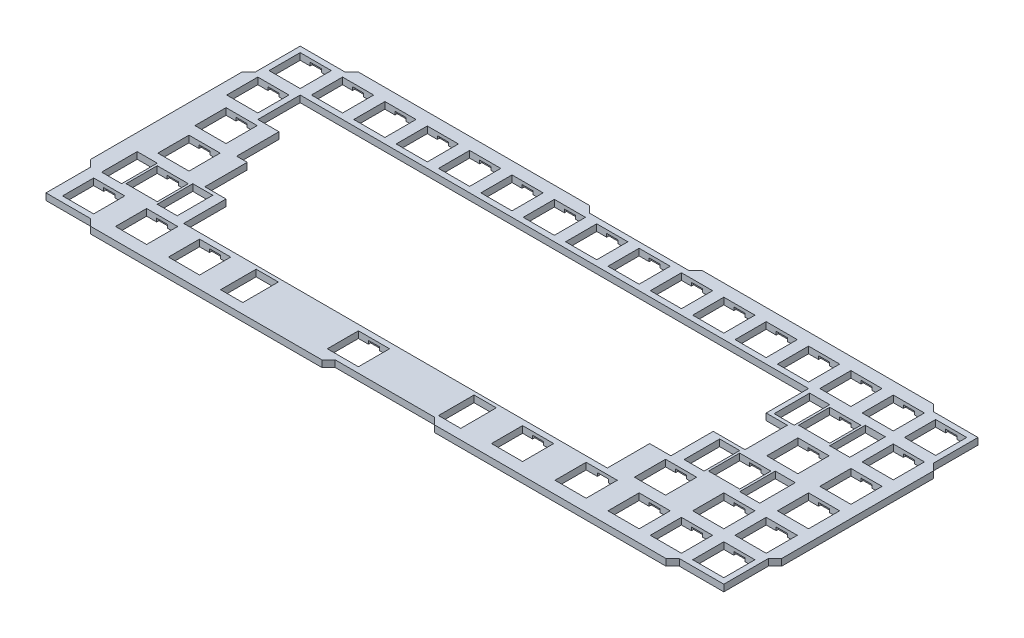
from build123d import *

# Parameters (mm, degrees)
SKETCH1_W           = 14
SKETCH1_H           = 14
BOSS_EXTRUDE1_DEPTH = 3
SKETCH2_W           = 9
SKETCH2_H           = 16
SKETCH2_W_2         = 10
CUT_EXTRUDE1_DEPTH  = 326.540366161
SKETCH3_W           = 5
SKETCH3_H           = 16
CUT_EXTRUDE2_DEPTH  = 1.5
SKETCH4_W           = 110
SKETCH4_H           = 3
BOSS_EXTRUDE2_DEPTH = 3
SKETCH5_W           = 110
SKETCH5_H           = 3
BOSS_EXTRUDE3_DEPTH = 3
SKETCH6_W           = 74.3
SKETCH6_H           = 3
BOSS_EXTRUDE4_DEPTH = 3
SKETCH7_W           = 74.3
SKETCH7_H           = 3
BOSS_EXTRUDE5_DEPTH = 3
CHAMFER3_SIZE       = 3


with BuildPart() as part:
    # Sketch1 → Boss-Extrude1 (new body)
    with BuildSketch(Plane(origin=(0, 0, 0), x_dir=(1, 0, 0), z_dir=(0, 1, 0))):
        Polygon((23.81, -114.3), (266.7, -114.3), (285.75, -114.3), (304.8, -114.3), (304.8, 0), (0, 0), (0, -114.3), align=None)
        with Locations((11.90625, -104.775)):
            Rectangle(SKETCH1_W, SKETCH1_H, mode=Mode.SUBTRACT)
        with Locations((35.71625, -104.775)):
            Rectangle(SKETCH1_W, SKETCH1_H, mode=Mode.SUBTRACT)
        with Locations((59.52625, -104.775)):
            Rectangle(SKETCH1_W, SKETCH1_H, mode=Mode.SUBTRACT)
        with Locations((21.43125, -85.725)):
            Rectangle(SKETCH1_W, SKETCH1_H, mode=Mode.SUBTRACT)
        with Locations((16.66875, -66.675)):
            Rectangle(SKETCH1_W, SKETCH1_H, mode=Mode.SUBTRACT)
        Polygon((233.3625, -95.25), (42.8625, -95.25), (42.8625, -76.2), (33.3375, -76.2), (33.3375, -57.15), (28.575, -57.15), (28.575, -38.1), (19.05, -38.1), (19.05, -19.05), (247.65, -19.05), (247.65, -38.1), (257.175, -38.1), (257.175, -57.15), (242.8875, -57.15), (242.8875, -76.2), (233.3625, -76.2), align=None, mode=Mode.SUBTRACT)
        with Locations((130.96375, -104.775)):
            Rectangle(SKETCH1_W, SKETCH1_H, mode=Mode.SUBTRACT)
        with Locations((204.7825, -104.775)):
            Rectangle(SKETCH1_W, SKETCH1_H, mode=Mode.SUBTRACT)
        with Locations((233.3625, -104.775)):
            Rectangle(SKETCH1_W, SKETCH1_H, mode=Mode.SUBTRACT)
        with Locations((257.175, -104.775)):
            Rectangle(SKETCH1_W, SKETCH1_H, mode=Mode.SUBTRACT)
        with Locations((276.225, -104.775)):
            Rectangle(SKETCH1_W, SKETCH1_H, mode=Mode.SUBTRACT)
        with Locations((295.275, -104.775)):
            Rectangle(SKETCH1_W, SKETCH1_H, mode=Mode.SUBTRACT)
        with Locations((250.03125, -85.725)):
            Rectangle(SKETCH1_W, SKETCH1_H, mode=Mode.SUBTRACT)
        with Locations((276.225, -85.725)):
            Rectangle(SKETCH1_W, SKETCH1_H, mode=Mode.SUBTRACT)
        with Locations((295.275, -85.725)):
            Rectangle(SKETCH1_W, SKETCH1_H, mode=Mode.SUBTRACT)
        with Locations((264.31875, -66.675)):
            Rectangle(SKETCH1_W, SKETCH1_H, mode=Mode.SUBTRACT)
        with Locations((295.275, -66.675)):
            Rectangle(SKETCH1_W, SKETCH1_H, mode=Mode.SUBTRACT)
        with Locations((14.2875, -47.625)):
            Rectangle(SKETCH1_W, SKETCH1_H, mode=Mode.SUBTRACT)
        with Locations((9.525, -28.575)):
            Rectangle(SKETCH1_W, SKETCH1_H, mode=Mode.SUBTRACT)
        with Locations((9.525, -9.525)):
            Rectangle(SKETCH1_W, SKETCH1_H, mode=Mode.SUBTRACT)
        with Locations((28.575, -9.525)):
            Rectangle(SKETCH1_W, SKETCH1_H, mode=Mode.SUBTRACT)
        with Locations((47.625, -9.525)):
            Rectangle(SKETCH1_W, SKETCH1_H, mode=Mode.SUBTRACT)
        with Locations((66.675, -9.525)):
            Rectangle(SKETCH1_W, SKETCH1_H, mode=Mode.SUBTRACT)
        with Locations((85.725, -9.525)):
            Rectangle(SKETCH1_W, SKETCH1_H, mode=Mode.SUBTRACT)
        with Locations((104.775, -9.525)):
            Rectangle(SKETCH1_W, SKETCH1_H, mode=Mode.SUBTRACT)
        with Locations((123.825, -9.525)):
            Rectangle(SKETCH1_W, SKETCH1_H, mode=Mode.SUBTRACT)
        with Locations((142.875, -9.525)):
            Rectangle(SKETCH1_W, SKETCH1_H, mode=Mode.SUBTRACT)
        with Locations((271.4625, -47.625)):
            Rectangle(SKETCH1_W, SKETCH1_H, mode=Mode.SUBTRACT)
        with Locations((295.275, -47.625)):
            Rectangle(SKETCH1_W, SKETCH1_H, mode=Mode.SUBTRACT)
        with Locations((161.925, -9.525)):
            Rectangle(SKETCH1_W, SKETCH1_H, mode=Mode.SUBTRACT)
        with Locations((180.975, -9.525)):
            Rectangle(SKETCH1_W, SKETCH1_H, mode=Mode.SUBTRACT)
        with Locations((200.025, -9.525)):
            Rectangle(SKETCH1_W, SKETCH1_H, mode=Mode.SUBTRACT)
        with Locations((219.075, -9.525)):
            Rectangle(SKETCH1_W, SKETCH1_H, mode=Mode.SUBTRACT)
        with Locations((266.7, -28.575)):
            Rectangle(SKETCH1_W, SKETCH1_H, mode=Mode.SUBTRACT)
        with Locations((295.275, -28.575)):
            Rectangle(SKETCH1_W, SKETCH1_H, mode=Mode.SUBTRACT)
        with Locations((238.125, -9.525)):
            Rectangle(SKETCH1_W, SKETCH1_H, mode=Mode.SUBTRACT)
        with Locations((257.175, -9.525)):
            Rectangle(SKETCH1_W, SKETCH1_H, mode=Mode.SUBTRACT)
        with Locations((276.225, -9.525)):
            Rectangle(SKETCH1_W, SKETCH1_H, mode=Mode.SUBTRACT)
        with Locations((295.275, -9.525)):
            Rectangle(SKETCH1_W, SKETCH1_H, mode=Mode.SUBTRACT)
    extrude(amount=BOSS_EXTRUDE1_DEPTH)

    # Sketch2 → Cut-Extrude1 (cut, through all)
    with BuildSketch(Plane(origin=(0, 3, 0), x_dir=(1, 0, 0), z_dir=(0, 1, 0))):
        with Locations((254.2, -28.575)):
            Rectangle(SKETCH2_W, SKETCH2_H)
        with Locations((279.2, -28.575)):
            Rectangle(SKETCH2_W, SKETCH2_H)
        with Locations((276.81875, -66.675)):
            Rectangle(SKETCH2_W, SKETCH2_H)
        with Locations((251.81875, -66.675)):
            Rectangle(SKETCH2_W, SKETCH2_H)
        with Locations((179.96375, -104.775)):
            Rectangle(SKETCH2_W_2, SKETCH2_H)
        with Locations((81.96375, -104.775)):
            Rectangle(SKETCH2_W_2, SKETCH2_H)
        with Locations((33.93125, -85.725)):
            Rectangle(SKETCH2_W, SKETCH2_H)
        with Locations((8.93125, -85.725)):
            Rectangle(SKETCH2_W, SKETCH2_H)
    extrude(amount=-CUT_EXTRUDE1_DEPTH, mode=Mode.SUBTRACT)

    # Sketch3 → Cut-Extrude2 (cut)
    with BuildSketch(Plane.XZ):
        with Locations((295.275, 9.525)):
            Rectangle(SKETCH3_W, SKETCH3_H)
        with Locations((276.225, 9.525)):
            Rectangle(SKETCH3_W, SKETCH3_H)
        with Locations((257.175, 9.525)):
            Rectangle(SKETCH3_W, SKETCH3_H)
        with Locations((238.125, 9.525)):
            Rectangle(SKETCH3_W, SKETCH3_H)
        with Locations((219.075, 9.525)):
            Rectangle(SKETCH3_W, SKETCH3_H)
        with Locations((200.025, 9.525)):
            Rectangle(SKETCH3_W, SKETCH3_H)
        with Locations((180.975, 9.525)):
            Rectangle(SKETCH3_W, SKETCH3_H)
        with Locations((161.925, 9.525)):
            Rectangle(SKETCH3_W, SKETCH3_H)
        with Locations((142.875, 9.525)):
            Rectangle(SKETCH3_W, SKETCH3_H)
        with Locations((123.825, 9.525)):
            Rectangle(SKETCH3_W, SKETCH3_H)
        with Locations((104.775, 9.525)):
            Rectangle(SKETCH3_W, SKETCH3_H)
        with Locations((85.725, 9.525)):
            Rectangle(SKETCH3_W, SKETCH3_H)
        with Locations((66.675, 9.525)):
            Rectangle(SKETCH3_W, SKETCH3_H)
        with Locations((47.625, 9.525)):
            Rectangle(SKETCH3_W, SKETCH3_H)
        with Locations((28.575, 9.525)):
            Rectangle(SKETCH3_W, SKETCH3_H)
        with Locations((9.525, 9.525)):
            Rectangle(SKETCH3_W, SKETCH3_H)
        with Locations((295.275, 28.575)):
            Rectangle(SKETCH3_W, SKETCH3_H)
        with Locations((295.275, 47.625)):
            Rectangle(SKETCH3_W, SKETCH3_H)
        with Locations((295.275, 66.675)):
            Rectangle(SKETCH3_W, SKETCH3_H)
        with Locations((295.275, 85.725)):
            Rectangle(SKETCH3_W, SKETCH3_H)
        with Locations((276.225, 85.725)):
            Rectangle(SKETCH3_W, SKETCH3_H)
        with Locations((276.225, 104.775)):
            Rectangle(SKETCH3_W, SKETCH3_H)
        with Locations((295.275, 104.775)):
            Rectangle(SKETCH3_W, SKETCH3_H)
        with Locations((257.175, 104.775)):
            Rectangle(SKETCH3_W, SKETCH3_H)
        with Locations((9.525, 28.575)):
            Rectangle(SKETCH3_W, SKETCH3_H)
        with Locations((266.7, 28.575)):
            Rectangle(SKETCH3_W, SKETCH3_H)
        with Locations((271.4625, 47.625)):
            Rectangle(SKETCH3_W, SKETCH3_H)
        with Locations((264.31875, 66.675)):
            Rectangle(SKETCH3_W, SKETCH3_H)
        with Locations((250.03125, 85.725)):
            Rectangle(SKETCH3_W, SKETCH3_H)
        with Locations((233.891514314, 104.042871626)):
            Rectangle(SKETCH3_W, SKETCH3_H)
        with Locations((204.7825, 104.775)):
            Rectangle(SKETCH3_W, SKETCH3_H)
        with Locations((130.96375, 104.775)):
            Rectangle(SKETCH3_W, SKETCH3_H)
        with Locations((59.52625, 104.775)):
            Rectangle(SKETCH3_W, SKETCH3_H)
        with Locations((35.71625, 104.775)):
            Rectangle(SKETCH3_W, SKETCH3_H)
        with Locations((11.90625, 104.775)):
            Rectangle(SKETCH3_W, SKETCH3_H)
        with Locations((21.43125, 85.725)):
            Rectangle(SKETCH3_W, SKETCH3_H)
        with Locations((16.66875, 66.675)):
            Rectangle(SKETCH3_W, SKETCH3_H)
        with Locations((14.2875, 47.625)):
            Rectangle(SKETCH3_W, SKETCH3_H)
    extrude(amount=-CUT_EXTRUDE2_DEPTH, mode=Mode.SUBTRACT)

    # Sketch4 → Boss-Extrude2 (add)
    with BuildSketch(Plane.XY.offset(114.3)):
        with Locations((75, 1.5)):
            Rectangle(SKETCH4_W, SKETCH4_H)
        with Locations((229.8, 1.5)):
            Rectangle(SKETCH4_W, SKETCH4_H)
    extrude(amount=BOSS_EXTRUDE2_DEPTH)

    # Sketch5 → Boss-Extrude3 (add)
    with BuildSketch(Plane(origin=(0, 0, 0), x_dir=(-1, 0, 0), z_dir=(0, 0, -1))):
        with Locations((-75, 1.5)):
            Rectangle(SKETCH5_W, SKETCH5_H)
        with Locations((-229.8, 1.5)):
            Rectangle(SKETCH5_W, SKETCH5_H)
    extrude(amount=BOSS_EXTRUDE3_DEPTH)

    # Sketch6 → Boss-Extrude4 (add)
    with BuildSketch(Plane(origin=(304.8, 0, 0), x_dir=(0, 0, -1), z_dir=(1, 0, 0))):
        with Locations((-57.15, 1.5)):
            Rectangle(SKETCH6_W, SKETCH6_H)
    extrude(amount=BOSS_EXTRUDE4_DEPTH)

    # Sketch7 → Boss-Extrude5 (add)
    with BuildSketch(Plane.ZY):
        with Locations((57.15, 1.5)):
            Rectangle(SKETCH7_W, SKETCH7_H)
    extrude(amount=BOSS_EXTRUDE5_DEPTH)

    # Chamfer3
    chamfer3_edges = [part.edges().sort_by_distance(p)[0] for p in [
        (307.8, 1.5, 94.3),
        (307.8, 1.5, 20),
        (174.8, 1.5, -3),
        (284.8, 1.5, -3),
        (20, 1.5, -3),
        (130, 1.5, -3),
        (284.8, 1.5, 117.3),
        (174.8, 1.5, 117.3),
        (130, 1.5, 117.3),
        (20, 1.5, 117.3),
        (-3, 1.5, 20),
        (-3, 1.5, 94.3),
    ]]
    chamfer(chamfer3_edges, length=CHAMFER3_SIZE - 0.0001)  # a hair under: the kernel refuses the full size


solid = part.part
